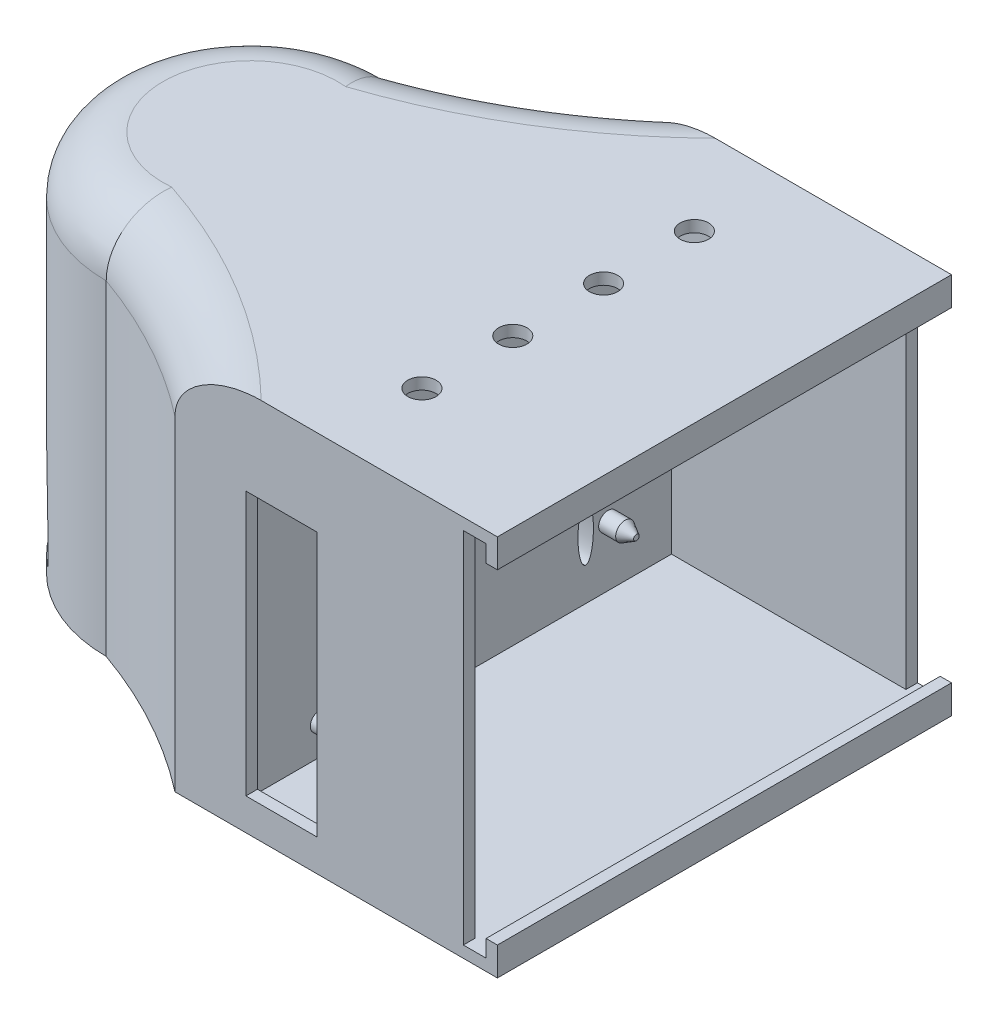
from build123d import *
from OCP.BRepFilletAPI import BRepFilletAPI_MakeChamfer

# Parameters (mm, degrees)
BOSS_EXTRUDE2_DEPTH     = 67.31
FILLET1_R               = 10
SKETCH2_W               = 75.946
SKETCH2_H               = 63.246
CUT_EXTRUDE1_DEPTH      = 41.31
SKETCH3_R               = 1.651
BOSS_EXTRUDE3_DEPTH     = 5
CHAMFER1_SIZE           = 2
CHAMFER1_SIZE2          = 1.154700538
CUT_EXTRUDE3_DEPTH      = 52
CUT_EXTRUDE4_DEPTH      = 25
CUT_EXTRUDE4_DEPTH_BACK = 25
SKETCH7_W               = 19
SKETCH7_H               = 12
SKETCH8_RX              = 4.869968375
SKETCH8_RY              = 1.367382804
CUT_EXTRUDE5_DEPTH      = 101.947236771
SKETCH5_W               = 12.523018164
SKETCH5_H               = 46.522194605
CUT_EXTRUDE6_DEPTH      = 10
SKETCH9_R               = 2.5
CUT_EXTRUDE7_DEPTH      = 10
SKETCH10_W              = 80.01
SKETCH10_H              = 2.032
BOSS_EXTRUDE4_DEPTH     = 6
SKETCH11_W              = 2
SKETCH11_H              = 80.01
BOSS_EXTRUDE6_DEPTH     = 3
SKETCH12_W              = 2
SKETCH12_H              = 80.01
BOSS_EXTRUDE7_DEPTH     = 3


with BuildPart() as part:
    # Sketch1 → Boss-Extrude2 (new body)
    with BuildSketch(Plane(origin=(0, 0, 0), x_dir=(1, 0, 0), z_dir=(0, 1, 0))):
        with BuildLine():
            Line((28.512569605, 26.806942292), (-22.287430395, 26.806942292))
            ThreePointArc((-22.287430395, 26.806942292), (-35.064642425, 18.429570328), (-49.016493819, 12.201942292))
            ThreePointArc((-49.016493819, 12.201942292), (-74.416493819, -13.198057708), (-49.016493819, -38.598057708))
            ThreePointArc((-49.016493819, -38.598057708), (-35.064642425, -44.825685743), (-22.287430395, -53.203057708))
            Line((-22.287430395, -53.203057708), (28.512569605, -53.203057708))
            Line((28.512569605, -53.203057708), (28.512569605, 26.806942292))
        make_face()
    extrude(amount=BOSS_EXTRUDE2_DEPTH)

    # Fillet1
    fillet1_edges = [part.edges().sort_by_distance(p)[0] for p in [
        (-35.064642425, 67.31, 44.825685743),
        (-74.416493819, 67.31, 13.198057708),
        (-35.064642425, 67.31, -18.429570328),
    ]]
    fillet(fillet1_edges, radius=FILLET1_R)

    # Sketch2 → Cut-Extrude1 (cut)
    with BuildSketch(Plane(origin=(28.512569605, 0, 0), x_dir=(0, 0, -1), z_dir=(1, 0, 0))):
        with Locations((-13.198057708, 33.655)):
            Rectangle(SKETCH2_W, SKETCH2_H)
    extrude(amount=-CUT_EXTRUDE1_DEPTH, mode=Mode.SUBTRACT)

    # Sketch3 → Boss-Extrude3 (add)
    with BuildSketch(Plane(origin=(-12.797430395, 0, 0), x_dir=(0, 0, -1), z_dir=(1, 0, 0))):
        with Locations((-37.201057708, 55.824657448)):
            Circle(SKETCH3_R)
        with Locations((-37.201057708, 7.564657448)):
            Circle(SKETCH3_R)
        with Locations((13.598942292, 40.584657448)):
            Circle(SKETCH3_R)
        with Locations((13.598942292, 12.644657448)):
            Circle(SKETCH3_R)
    extrude(amount=BOSS_EXTRUDE3_DEPTH)

    # Chamfer1: one chamfer whose edges measure the first distance from different faces: ONE call of the kernel's chamfer builder (chamfer() names one face for all edges)
    chamfer1_edges_1 = [part.edges().sort_by_distance(p)[0] for p in [
        (-7.797430395, 12.644657448, -11.947942292),
    ]]
    chamfer1_side_1 = [part.faces().sort_by_distance(p)[0] for p in [
        (-10.297430395, 12.644657448, -11.947942292),
    ]]
    chamfer1_edges_2 = [part.edges().sort_by_distance(p)[0] for p in [
        (-7.797430395, 40.584657448, -11.947942292),
    ]]
    chamfer1_side_2 = [part.faces().sort_by_distance(p)[0] for p in [
        (-10.297430395, 40.584657448, -11.947942292),
    ]]
    chamfer1_edges_3 = [part.edges().sort_by_distance(p)[0] for p in [
        (-7.797430395, 55.824657448, 38.852057708),
    ]]
    chamfer1_side_3 = [part.faces().sort_by_distance(p)[0] for p in [
        (-10.297430395, 55.824657448, 38.852057708),
    ]]
    chamfer1_edges_4 = [part.edges().sort_by_distance(p)[0] for p in [
        (-7.797430395, 7.564657448, 38.852057708),
    ]]
    chamfer1_side_4 = [part.faces().sort_by_distance(p)[0] for p in [
        (-10.297430395, 7.564657448, 38.852057708),
    ]]
    chamfer1 = BRepFilletAPI_MakeChamfer(part.part.solid().wrapped)
    for e in chamfer1_edges_1:
        chamfer1.Add(CHAMFER1_SIZE, CHAMFER1_SIZE2, e.wrapped, chamfer1_side_1[0].wrapped)  # the first distance lies on this face
    for e in chamfer1_edges_2:
        chamfer1.Add(CHAMFER1_SIZE, CHAMFER1_SIZE2, e.wrapped, chamfer1_side_2[0].wrapped)  # the first distance lies on this face
    for e in chamfer1_edges_3:
        chamfer1.Add(CHAMFER1_SIZE, CHAMFER1_SIZE2, e.wrapped, chamfer1_side_3[0].wrapped)  # the first distance lies on this face
    for e in chamfer1_edges_4:
        chamfer1.Add(CHAMFER1_SIZE, CHAMFER1_SIZE2, e.wrapped, chamfer1_side_4[0].wrapped)  # the first distance lies on this face
    add(Compound.cast(chamfer1.Shape()), mode=Mode.REPLACE)

    # Sketch4 → Cut-Extrude3 (cut)
    with BuildSketch(Plane(origin=(-76.2, 0, 0), x_dir=(0, 0, -1), z_dir=(1, 0, 0))):
        with BuildLine():
            Line((6.890730221, 2.888701934), (-33.286845636, 2.888701934))
            add(Edge.make_bspline(
                [(6.890730221, 2.888701934), (6.890730221, 51.375976578), (-13.198057708, 51.375976578), (-33.286845636, 51.375976578), (-33.286845636, 2.888701934)],
                knots=[4.71238898, 4.71238898, 4.71238898, 6.283185307, 6.283185307, 7.853981634, 7.853981634, 7.853981634], degree=2, weights=[1, 0.707106781, 1, 0.707106781, 1]))
        make_face()
    extrude(amount=CUT_EXTRUDE3_DEPTH, mode=Mode.SUBTRACT)

    # Sketch7 → Cut-Extrude4 (cut, two sides: drawn at the far end of the back side and taken through both)
    with BuildSketch(Plane.XY.offset(13.198057708).offset(-CUT_EXTRUDE4_DEPTH_BACK)):
        with Locations((-34.177120444, 12.926995259)):
            Rectangle(SKETCH7_W, SKETCH7_H)
    extrude(amount=CUT_EXTRUDE4_DEPTH + CUT_EXTRUDE4_DEPTH_BACK, mode=Mode.SUBTRACT)

    # Sketch8 → Cut-Extrude5 (cut, through all)
    with BuildSketch(Plane.ZY.offset(24.677120444)):
        with Locations(Location((-9.66538742, 12.775075764), (0, 0, -90))):
            Ellipse(SKETCH8_RX, SKETCH8_RY)
        with Locations(Location((35.24218315, 12.775075764), (0, 0, -90))):
            Ellipse(SKETCH8_RX, SKETCH8_RY)
    extrude(amount=-CUT_EXTRUDE5_DEPTH, mode=Mode.SUBTRACT)

    # Sketch5 → Cut-Extrude6 (cut)
    with BuildSketch(Plane.XY.offset(53.203057708)):
        with Locations((-3.535921313, 28.885508059)):
            Rectangle(SKETCH5_W, SKETCH5_H)
    extrude(amount=-CUT_EXTRUDE6_DEPTH, mode=Mode.SUBTRACT)

    # Sketch9 → Cut-Extrude7 (cut)
    with BuildSketch(Plane(origin=(0, 67.31, 0), x_dir=(1, 0, 0), z_dir=(0, 1, 0))):
        with Locations((5.210711632, -37.193057708)):
            Circle(SKETCH9_R)
        with Locations((5.210711632, -21.193057708)):
            Circle(SKETCH9_R)
        with Locations((5.210711632, -5.193057708)):
            Circle(SKETCH9_R)
        with Locations((5.210711632, 10.806942292)):
            Circle(SKETCH9_R)
    extrude(amount=-CUT_EXTRUDE7_DEPTH, mode=Mode.SUBTRACT)

    # Sketch10 → Boss-Extrude4 (add)
    with BuildSketch(Plane(origin=(28.512569605, 0, 0), x_dir=(0, 0, -1), z_dir=(1, 0, 0))):
        with Locations((-13.198057708, 66.294)):
            Rectangle(SKETCH10_W, SKETCH10_H)
        with Locations((-13.198057708, 1.016)):
            Rectangle(SKETCH10_W, SKETCH10_H)
    extrude(amount=BOSS_EXTRUDE4_DEPTH)

    # Sketch11 → Boss-Extrude6 (add)
    with BuildSketch(Plane.XZ.offset(-65.278)):
        with Locations((33.512569605, 13.198057708)):
            Rectangle(SKETCH11_W, SKETCH11_H)
    extrude(amount=BOSS_EXTRUDE6_DEPTH)

    # Sketch12 → Boss-Extrude7 (add)
    with BuildSketch(Plane(origin=(0, 2.032, 0), x_dir=(1, 0, 0), z_dir=(0, 1, 0))):
        with Locations((33.512569605, -13.198057708)):
            Rectangle(SKETCH12_W, SKETCH12_H)
    extrude(amount=BOSS_EXTRUDE7_DEPTH)


solid = part.part
